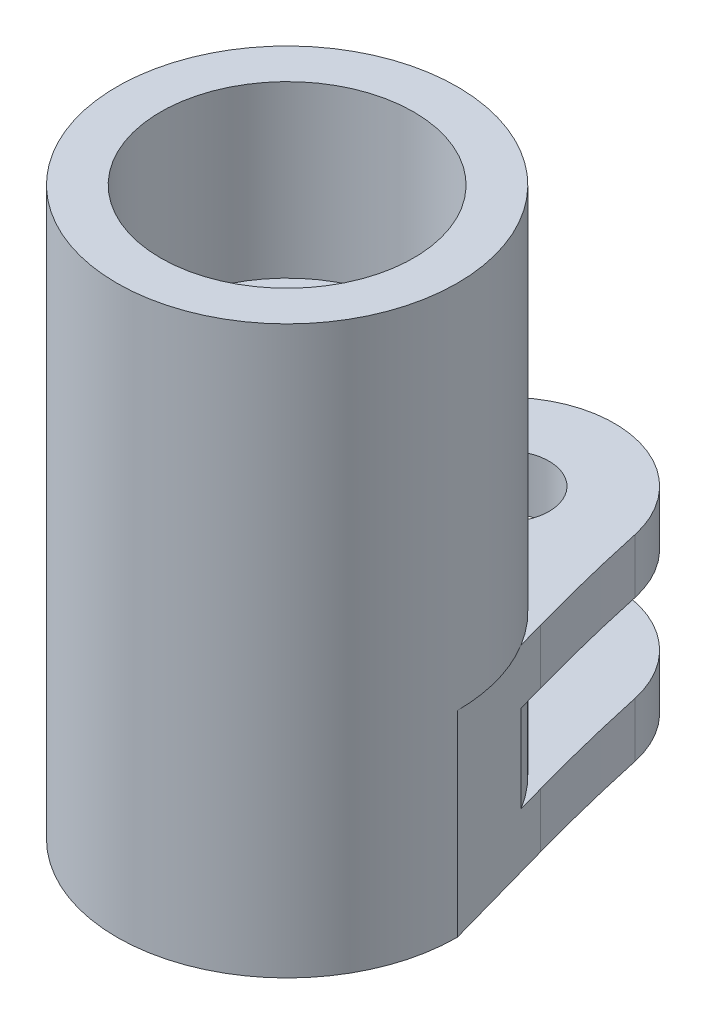
from build123d import *

# Parameters (mm, degrees)
SALIENTE_EXTRUIR1_DEPTH = 4.5
CROQUIS3_R              = 2.9
CROQUIS3_R_2            = 1
CORTAR_EXTRUIR1_DEPTH   = 10.57653382
CROQUIS4_R              = 3.9
CROQUIS4_R_2            = 2.9
SALIENTE_EXTRUIR2_DEPTH = 5
CROQUIS6_R              = 3.9
CROQUIS6_R_2            = 2.9
SALIENTE_EXTRUIR3_DEPTH = 3.48
CORTAR_EXTRUIR3_START   = -2.25
CORTAR_EXTRUIR3_DEPTH   = 1
SALIENTE_EXTRUIR4_START = -8.08
CROQUIS7_R              = 2.9
CROQUIS7_R_2            = 1.5
SALIENTE_EXTRUIR4_DEPTH = 1
REDONDEO1_R             = 50


with BuildPart() as part:
    # Croquis1 → Saliente-Extruir1 (new body)
    with BuildSketch(Plane(origin=(0, 0, 0), x_dir=(1, 0, 0), z_dir=(0, 1, 0))):
        with BuildLine():
            Line((-3.9, 0), (-2.5, 5))
            ThreePointArc((-2.5, 5), (0, 7.5), (2.5, 5))
            Line((2.5, 5), (3.9, 0))
            ThreePointArc((3.9, 0), (0, -3.9), (-3.9, 0))
        make_face()
    extrude(amount=SALIENTE_EXTRUIR1_DEPTH)

    # Croquis3 → Cortar-Extruir1 (cut, through all)
    with BuildSketch(Plane(origin=(0, 4.5, 0), x_dir=(1, 0, 0), z_dir=(0, 1, 0))):
        Circle(CROQUIS3_R)
        with Locations((0, 5)):
            Circle(CROQUIS3_R_2)
    extrude(amount=-CORTAR_EXTRUIR1_DEPTH, mode=Mode.SUBTRACT)

    # Croquis4 → Saliente-Extruir2 (add)
    with BuildSketch(Plane(origin=(0, 4.5, 0), x_dir=(1, 0, 0), z_dir=(0, 1, 0))):
        Circle(CROQUIS4_R)
        Circle(CROQUIS4_R_2, mode=Mode.SUBTRACT)
    extrude(amount=SALIENTE_EXTRUIR2_DEPTH)

    # Croquis6 → Saliente-Extruir3 (add)
    with BuildSketch(Plane(origin=(0, 9.5, 0), x_dir=(1, 0, 0), z_dir=(0, 1, 0))):
        Circle(CROQUIS6_R)
        Circle(CROQUIS6_R_2, mode=Mode.SUBTRACT)
    extrude(amount=SALIENTE_EXTRUIR3_DEPTH)

    # Croquis5 → Cortar-Extruir3 (cut, symmetric)
    with BuildSketch(Plane(origin=(0, 4.5, 0), x_dir=(1, 0, 0), z_dir=(0, 1, 0)).offset(CORTAR_EXTRUIR3_START)):
        with BuildLine():
            Line((3.332937685, 2.025222552), (2.5, 5))
            ThreePointArc((2.5, 5), (0, 7.5), (-2.5, 5))
            Line((-2.5, 5), (-3.332937685, 2.025222552))
            ThreePointArc((-3.332937685, 2.025222552), (0, 3.9), (3.332937685, 2.025222552))
        make_face()
    extrude(amount=CORTAR_EXTRUIR3_DEPTH, both=True, mode=Mode.SUBTRACT)

    # Croquis7 → Saliente-Extruir4 (add)
    with BuildSketch(Plane.XZ.offset(SALIENTE_EXTRUIR4_START)):
        Circle(CROQUIS7_R)
        Circle(CROQUIS7_R_2, mode=Mode.SUBTRACT)
    extrude(amount=-SALIENTE_EXTRUIR4_DEPTH)

    # Redondeo1
    redondeo1_edges = [part.edges().sort_by_distance(p)[0] for p in [
        (2.5, 3.875, -5),
        (2.5, 0.625, -5),
        (-2.5, 0.625, -5),
        (-2.5, 3.875, -5),
    ]]
    fillet(redondeo1_edges, radius=REDONDEO1_R)


solid = part.part
